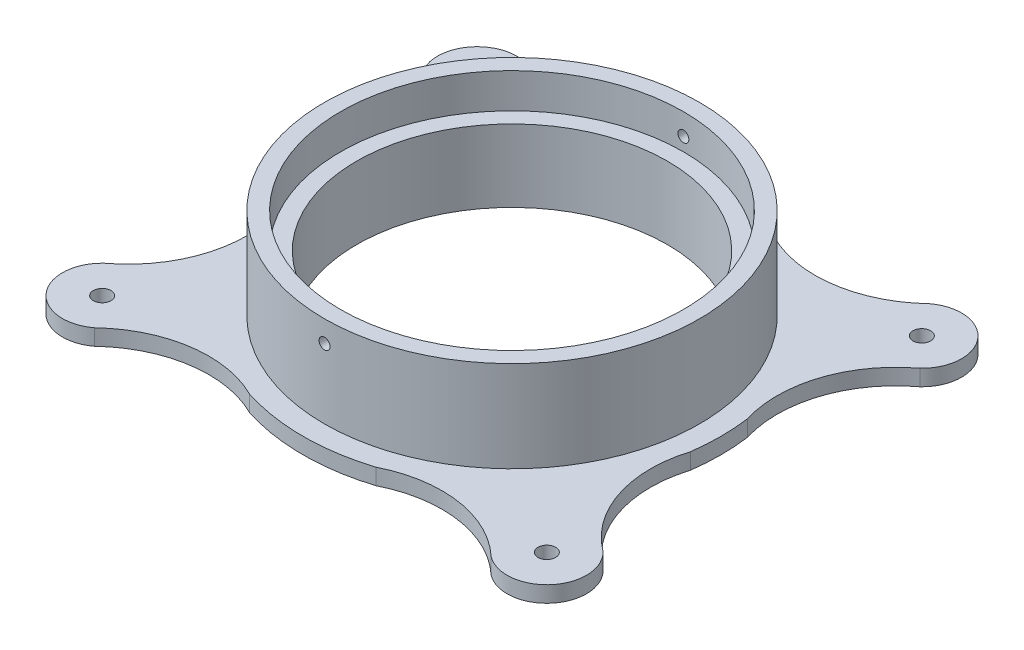
from build123d import *

# Parameters (mm, degrees)
EXTRUDE_2_DEPTH     = 3
SKETCH_2_R          = 35
EXTRUDE_3_DEPTH     = 17
SKETCH_10_W         = 1.025
SKETCH_10_H         = 42.416288383
HOLE_WIZARD_M4_2_D  = 3.3
SKETCH_28_R         = 32
CUT_EXTRUDE_1_DEPTH = 6.5
HOLE_WIZARD_M64_2_D = 58


with BuildPart() as part:
    # 草图1 → 凸台-拉伸2 (new body)
    with BuildSketch(Plane(origin=(0, 0, 0), x_dir=(1, 0, 0), z_dir=(0, 1, 0))):
        with BuildLine():
            ThreePointArc((37.022422142, 40.912074924), (47.169257948, 39.781301884), (46.571881267, 29.589144819))
            ThreePointArc((46.571881267, 29.589144819), (38.766254834, 18.72698333), (38.631055592, 5.351779505))
            ThreePointArc((38.631055592, 5.351779505), (39, 0), (38.631055592, -5.351779505))
            ThreePointArc((38.631055592, -5.351779505), (38.766254834, -18.72698333), (46.571881267, -29.589144819))
            ThreePointArc((46.571881267, -29.589144819), (47.169257948, -39.781301884), (37.022422142, -40.912074924))
            ThreePointArc((37.022422142, -40.912074924), (24.999035301, -35.050972205), (11.792759981, -37.174330014))
            ThreePointArc((11.792759981, -37.174330014), (0, -39), (-11.792759981, -37.174330014))
            ThreePointArc((-11.792759981, -37.174330014), (-24.999035301, -35.050972205), (-37.022422142, -40.912074924))
            ThreePointArc((-37.022422142, -40.912074924), (-47.169257948, -39.781301884), (-46.571881267, -29.589144819))
            ThreePointArc((-46.571881267, -29.589144819), (-38.766254834, -18.72698333), (-38.631055592, -5.351779505))
            ThreePointArc((-38.631055592, -5.351779505), (-39, 0), (-38.631055592, 5.351779505))
            ThreePointArc((-38.631055592, 5.351779505), (-38.766254834, 18.72698333), (-46.571881267, 29.589144819))
            ThreePointArc((-46.571881267, 29.589144819), (-47.169257948, 39.781301884), (-37.022422142, 40.912074924))
            ThreePointArc((-37.022422142, 40.912074924), (-24.999035301, 35.050972205), (-11.792759981, 37.174330014))
            ThreePointArc((-11.792759981, 37.174330014), (0, 39), (11.792759981, 37.174330014))
            ThreePointArc((11.792759981, 37.174330014), (24.999035301, 35.050972205), (37.022422142, 40.912074924))
        make_face()
    extrude(amount=EXTRUDE_2_DEPTH)

    # 草图2 → 凸台-拉伸3 (add)
    with BuildSketch(Plane(origin=(0, 3, 0), x_dir=(1, 0, 0), z_dir=(0, 1, 0))):
        Circle(SKETCH_2_R)
    extrude(amount=EXTRUDE_3_DEPTH)

    # 草图10 → M2.5 螺纹孔1 (revolve, cut)
    with BuildSketch(Plane(origin=(0, 16, 0), x_dir=(0, 1, 0), z_dir=(1, 0, 0))):
        with Locations((0.5125, 21.208144192)):
            Rectangle(SKETCH_10_W, SKETCH_10_H)
    hole_wizard_m2_5_1 = revolve(axis=Axis((0, 16, -6.35), (0, 0, 1)), mode=Mode.SUBTRACT)

    # 镜向3: M2.5 螺纹孔1 across plane
    add(hole_wizard_m2_5_1.mirror(Plane.XY), mode=Mode.SUBTRACT)

    # M4 螺纹孔2 (through all)
    with Locations(Plane(origin=(0, 20, 0), x_dir=(1, 0, 0), z_dir=(0, 1, 0))):
        with Locations((-41.5, 35), (-41.5, -35), (41.5, -35), (41.5, 35)):
            Hole(HOLE_WIZARD_M4_2_D / 2)

    # 草图28 → 切除-拉伸1 (cut)
    with BuildSketch(Plane(origin=(0, 20, 0), x_dir=(1, 0, 0), z_dir=(0, 1, 0))):
        Circle(SKETCH_28_R)
    extrude(amount=-CUT_EXTRUDE_1_DEPTH, mode=Mode.SUBTRACT)

    # M64 螺纹孔2 (through all)
    with Locations(Plane(origin=(0, 0, 0), x_dir=(-1, 0, 0), z_dir=(0, -1, 0))):
        with Locations((0, 0)):
            Hole(HOLE_WIZARD_M64_2_D / 2)


solid = part.part
